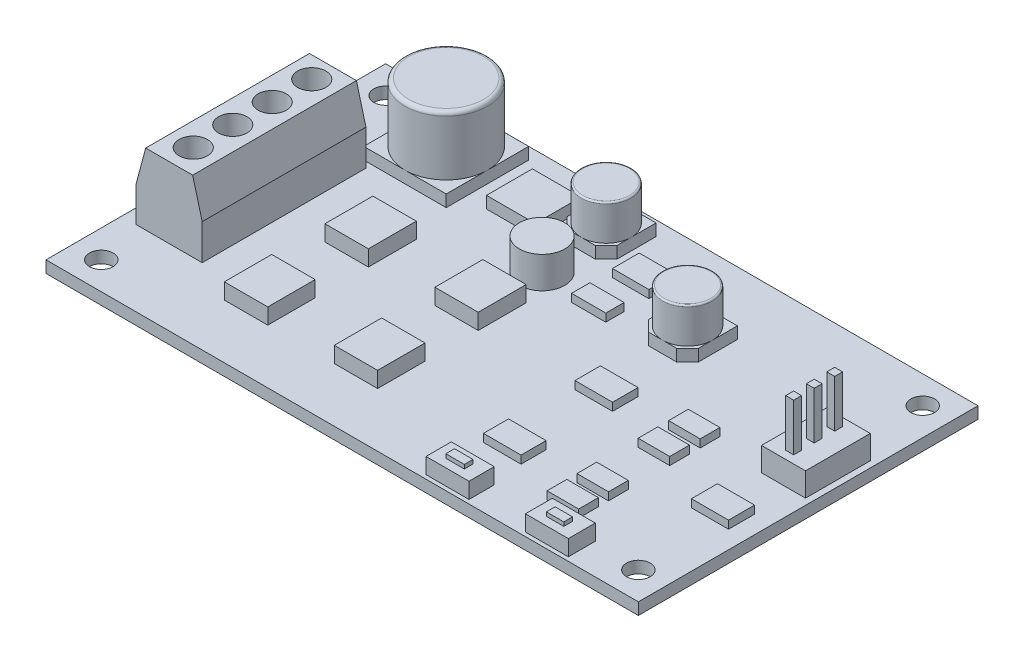
from build123d import *
from OCP.BRepFilletAPI import BRepFilletAPI_MakeChamfer

# Parameters (mm, degrees)
SKETCH1_W                 = 75
SKETCH1_H                 = 43
BOSS_EXTRUDE1_DEPTH       = 1.5
SKETCH2_R                 = 1.5
CUT_EXTRUDE3_DEPTH        = 1.5
SKETCH3_R                 = 5.221134654
BOSS_EXTRUDE2_DEPTH       = 1.5
SKETCH3_3_R               = 5.221134654
BOSS_EXTRUDE3_DEPTH       = 9
SKETCH4_W                 = 8.355581573
SKETCH4_H                 = 20.734220939
BOSS_EXTRUDE4_DEPTH       = 9
CHAMFER1_SIZE             = 4.5
CHAMFER1_SIZE2            = 1.205771366
SKETCH6_R                 = 1.797997368
CUT_EXTRUDE5_DEPTH        = 4.5
LPATTERN1_COUNT           = 4
LPATTERN1_PITCH           = 5
SKETCH7_W                 = 2.5
SKETCH7_H                 = 2.5
CUT_EXTRUDE6_DEPTH        = 4.5
LPATTERN2_COUNT           = 4
LPATTERN2_PITCH           = 5
SKETCH8_W                 = 5.5
SKETCH8_H                 = 6
BOSS_EXTRUDE5_DEPTH       = 2
SKETCH8_H_2               = 6.070615465
BOSS_EXTRUDE5_2_DEPTH     = 2
SKETCH8_W_2               = 5.485495902
BOSS_EXTRUDE5_3_DEPTH     = 2
BOSS_EXTRUDE5_4_DEPTH     = 2
SKETCH9_W                 = 6.182542378
SKETCH9_H                 = 5.809457925
BOSS_EXTRUDE6_DEPTH       = 1.5
SKETCH10_R                = 2.875811074
BOSS_EXTRUDE7_DEPTH       = 4
SKETCH11_R                = 3.157141776
BOSS_EXTRUDE8_DEPTH       = 1.5
BOSS_EXTRUDE9_OUTLINE_R   = 3.157141776
BOSS_EXTRUDE9_DEPTH       = 6
BOSS_EXTRUDE9_START       = 1.5
BOSS_EXTRUDE9_2_OUTLINE_R = 3.157141776
BOSS_EXTRUDE9_2_DEPTH     = 4.5
SKETCH12_W                = 4.75842572
SKETCH12_H                = 3.223449682
BOSS_EXTRUDE10_DEPTH      = 1
SKETCH12_H_2              = 3.17233498
BOSS_EXTRUDE10_2_DEPTH    = 1
SKETCH12_W_2              = 4.613337759
SKETCH12_H_3              = 3.395519095
BOSS_EXTRUDE10_3_DEPTH    = 1
SKETCH12_W_3              = 4.69505577
SKETCH12_H_4              = 3.299228379
BOSS_EXTRUDE10_4_DEPTH    = 1
SKETCH13_W                = 4
SKETCH13_H                = 2.5
BOSS_EXTRUDE11_DEPTH      = 1
BOSS_EXTRUDE11_2_DEPTH    = 1
BOSS_EXTRUDE11_3_DEPTH    = 1
BOSS_EXTRUDE11_4_DEPTH    = 1
SKETCH13_W_2              = 4.332523778
SKETCH13_H_2              = 2.320994881
BOSS_EXTRUDE11_5_DEPTH    = 1
SKETCH14_W                = 5.436373471
SKETCH14_H                = 3.197866748
BOSS_EXTRUDE12_DEPTH      = 2
SKETCH14_W_2              = 5.43637347
SKETCH14_H_2              = 3.411057864
BOSS_EXTRUDE12_2_DEPTH    = 2
SKETCH15_W                = 2.349877762
SKETCH15_H                = 1.101505201
SKETCH15_W_2              = 2.203010403
BOSS_EXTRUDE13_DEPTH      = 0.5
SKETCH16_W                = 5.570387715
SKETCH16_H                = 8.20084858
BOSS_EXTRUDE14_DEPTH      = 3
SKETCH17_W                = 1
SKETCH17_H                = 1
BOSS_EXTRUDE15_DEPTH      = 6
LPATTERN3_COUNT           = 3
LPATTERN3_PITCH           = 2.6
CHAMFER2_SIZE             = 0.5
CHAMFER2_SIZE2            = 0.866025404
FILLET1_R                 = 0.5
FILLET2_R                 = 0.2
FILLET3_R                 = 0.2


# Read off the part's stored shape, not the designer's step: Boss-Extrude9
with BuildPart() as part:
    # Sketch1 → Boss-Extrude1 (new body)
    with BuildSketch(Plane(origin=(0, 0, 0), x_dir=(1, 0, 0), z_dir=(0, 1, 0))):
        with Locations((37.5, 21.5)):
            Rectangle(SKETCH1_W, SKETCH1_H)
    extrude(amount=BOSS_EXTRUDE1_DEPTH)

    # Sketch2 → Cut-Extrude3 (cut)
    with BuildSketch(Plane(origin=(0, 1.5, 0), x_dir=(1, 0, 0), z_dir=(0, 1, 0))):
        with Locations(Location((3.5, 39.5, 0), (0, 0, 270))):
            Circle(SKETCH2_R)
        with Locations(Location((71.5, 39.5, 0), (0, 0, 270))):
            Circle(SKETCH2_R)
        with Locations(Location((71.5, 3.5, 0), (0, 0, 270))):
            Circle(SKETCH2_R)
        with Locations(Location((3.5, 3.5, 0), (0, 0, 270))):
            Circle(SKETCH2_R)
    extrude(amount=-CUT_EXTRUDE3_DEPTH, mode=Mode.SUBTRACT)


with BuildPart() as body_2:
    # Sketch3 → Boss-Extrude2 (new body)
    with BuildSketch(Plane(origin=(0, 1.5, 0), x_dir=(1, 0, 0), z_dir=(0, 1, 0))):
        with BuildLine():
            Line((9.174762249, 41.49737644), (9.174762249, 36.276241794))
            ThreePointArc((9.174762249, 36.276241794), (10.703997186, 39.968141508), (14.395896902, 41.49737644))
            Line((14.395896902, 41.49737644), (9.174762249, 41.49737644))
        make_face()
        with Locations((14.395896902, 36.276241787)):
            Circle(SKETCH3_R)
        with BuildLine():
            Line((19.617031556, 41.49737644), (14.395896902, 41.49737644))
            ThreePointArc((14.395896902, 41.49737644), (18.087796621, 39.968141506), (19.617031556, 36.276241787))
            Line((19.617031556, 36.276241787), (19.617031556, 41.49737644))
        make_face()
        with BuildLine():
            ThreePointArc((19.617031556, 36.276241787), (18.087796632, 32.584342079), (14.395896934, 31.055107133))
            Line((14.395896934, 31.055107133), (17.830593616, 31.055107133))
            Line((17.830593616, 31.055107133), (19.617031556, 32.841545073))
            Line((19.617031556, 32.841545073), (19.617031556, 36.276241787))
        make_face()
        Polygon((19.617031556, 32.841545073), (17.830593616, 31.055107133), (19.617031556, 31.055107133), align=None)
        Polygon((10.961200189, 31.055107133), (9.174762249, 32.841545073), (9.174762249, 31.055107133), align=None)
        with BuildLine():
            Line((9.174762249, 36.276241794), (9.174762249, 32.841545073))
            Line((9.174762249, 32.841545073), (10.961200189, 31.055107133))
            Line((10.961200189, 31.055107133), (14.395896934, 31.055107133))
            ThreePointArc((14.395896934, 31.055107133), (10.703997192, 32.584342059), (9.174762249, 36.276241794))
        make_face()
    extrude(amount=BOSS_EXTRUDE2_DEPTH)

    # Sketch3<3> → Boss-Extrude3 (add)
    with BuildSketch(Plane(origin=(0, 1.5, 0), x_dir=(1, 0, 0), z_dir=(0, 1, 0))):
        with Locations(Location((14.395896902, 36.276241787, 0), (0, 0, 270))):
            Circle(SKETCH3_3_R)
    extrude(amount=BOSS_EXTRUDE3_DEPTH)

    # Fillet1
    fillet1_edges = [body_2.edges().sort_by_distance(p)[0] for p in [
        (14.395896902, 10.5, -41.49737644),
    ]]
    fillet(fillet1_edges, radius=FILLET1_R)


with BuildPart() as body_3:
    # Sketch4 → Boss-Extrude4 (new body)
    with BuildSketch(Plane(origin=(0, 1.5, 0), x_dir=(1, 0, 0), z_dir=(0, 1, 0))):
        with Locations((6.026906426, 19.936405532)):
            Rectangle(SKETCH4_W, SKETCH4_H)
    extrude(amount=BOSS_EXTRUDE4_DEPTH)

    # Chamfer1: one chamfer whose edges measure the first distance from different faces: ONE call of the kernel's chamfer builder (chamfer() names one face for all edges)
    chamfer1_edges_1 = [body_3.edges().sort_by_distance(p)[0] for p in [
        (1.849115639, 10.5, -19.936405532),
    ]]
    chamfer1_side_1 = [body_3.faces().sort_by_distance(p)[0] for p in [
        (1.849115639, 6, -19.936405532),
    ]]
    chamfer1_edges_2 = [body_3.edges().sort_by_distance(p)[0] for p in [
        (10.204697212, 10.5, -19.936405532),
    ]]
    chamfer1_side_2 = [body_3.faces().sort_by_distance(p)[0] for p in [
        (10.204697212, 6, -19.936405532),
    ]]
    chamfer1 = BRepFilletAPI_MakeChamfer(body_3.part.solid().wrapped)
    for e in chamfer1_edges_1:
        chamfer1.Add(CHAMFER1_SIZE, CHAMFER1_SIZE2, e.wrapped, chamfer1_side_1[0].wrapped)  # the first distance lies on this face
    for e in chamfer1_edges_2:
        chamfer1.Add(CHAMFER1_SIZE, CHAMFER1_SIZE2, e.wrapped, chamfer1_side_2[0].wrapped)  # the first distance lies on this face
    add(Compound.cast(chamfer1.Shape()), mode=Mode.REPLACE)

    # Sketch6 → Cut-Extrude5 (cut)
    with BuildSketch(Plane(origin=(0, 10.5, 0), x_dir=(1, 0, 0), z_dir=(0, 1, 0))):
        with Locations(Location((6.021763667, 27.62235107, 0), (0, 0, 270))):
            Circle(SKETCH6_R)
    cut_extrude5 = extrude(amount=-CUT_EXTRUDE5_DEPTH, mode=Mode.SUBTRACT)

    # LPattern1: Cut-Extrude5 ×4
    with Locations(*[(0, 0, i * LPATTERN1_PITCH) for i in range(1, LPATTERN1_COUNT)]):
        add(cut_extrude5, mode=Mode.SUBTRACT)

    # Sketch7 → Cut-Extrude6 (cut)
    with BuildSketch(Plane.ZY.offset(-1.849115639)):
        with Locations((-27.62235107, 3.75)):
            Rectangle(SKETCH7_W, SKETCH7_H)
    cut_extrude6 = extrude(amount=-CUT_EXTRUDE6_DEPTH, mode=Mode.SUBTRACT)

    # LPattern2: Cut-Extrude6 ×4
    with Locations(*[(0, 0, i * LPATTERN2_PITCH) for i in range(1, LPATTERN2_COUNT)]):
        add(cut_extrude6, mode=Mode.SUBTRACT)

    # Chamfer2
    chamfer2_edges = [body_3.edges().sort_by_distance(p)[0] for p in [
        (1.849115639, 3.75, -26.37235107),
        (1.849115639, 5, -27.62235107),
        (1.849115639, 3.75, -28.87235107),
        (1.849115639, 2.5, -27.62235107),
        (1.849115639, 3.75, -21.37235107),
        (1.849115639, 5, -22.62235107),
        (1.849115639, 3.75, -23.87235107),
        (1.849115639, 2.5, -22.62235107),
        (1.849115639, 3.75, -16.37235107),
        (1.849115639, 5, -17.62235107),
        (1.849115639, 3.75, -18.87235107),
        (1.849115639, 2.5, -17.62235107),
        (1.849115639, 3.75, -11.37235107),
        (1.849115639, 5, -12.62235107),
        (1.849115639, 3.75, -13.87235107),
        (1.849115639, 2.5, -12.62235107),
    ]]
    chamfer2_side = [body_3.faces().sort_by_distance(p)[0] for p in [
        (1.849115639, 3.75, -19.868347455),
    ]]
    chamfer(chamfer2_edges, length=CHAMFER2_SIZE, length2=CHAMFER2_SIZE2, reference=chamfer2_side[0])


with BuildPart() as body_4:
    # Sketch8 → Boss-Extrude5 (new body)
    with BuildSketch(Plane(origin=(0, 1.5, 0), x_dir=(1, 0, 0), z_dir=(0, 1, 0))):
        with Locations((18.451726118, 9.875042273)):
            Rectangle(SKETCH8_W, SKETCH8_H)
    extrude(amount=BOSS_EXTRUDE5_DEPTH)


with BuildPart() as body_5:
    # Sketch8 → Boss-Extrude5 2 (new body)
    with BuildSketch(Plane(origin=(0, 1.5, 0), x_dir=(1, 0, 0), z_dir=(0, 1, 0))):
        with Locations((18.451726118, 22.647353546)):
            Rectangle(SKETCH8_W, SKETCH8_H_2)
    extrude(amount=BOSS_EXTRUDE5_2_DEPTH)


with BuildPart() as body_6:
    # Sketch8 → Boss-Extrude5 3 (new body)
    with BuildSketch(Plane(origin=(0, 1.5, 0), x_dir=(1, 0, 0), z_dir=(0, 1, 0))):
        with Locations((32.365114797, 22.647353546)):
            Rectangle(SKETCH8_W_2, SKETCH8_H_2)
    extrude(amount=BOSS_EXTRUDE5_3_DEPTH)


with BuildPart() as body_7:
    # Sketch8 → Boss-Extrude5 4 (new body)
    with BuildSketch(Plane(origin=(0, 1.5, 0), x_dir=(1, 0, 0), z_dir=(0, 1, 0))):
        with Locations((32.365114797, 9.875042273)):
            Rectangle(SKETCH8_W_2, SKETCH8_H)
    extrude(amount=BOSS_EXTRUDE5_4_DEPTH)


with BuildPart() as body_8:
    # Sketch9 → Boss-Extrude6 (new body)
    with BuildSketch(Plane(origin=(0, 1.5, 0), x_dir=(1, 0, 0), z_dir=(0, 1, 0))):
        with Locations((25.403033281, 36.358052628)):
            Rectangle(SKETCH9_W, SKETCH9_H)
    extrude(amount=BOSS_EXTRUDE6_DEPTH)


with BuildPart() as body_9:
    # Sketch10 → Boss-Extrude7 (new body)
    with BuildSketch(Plane(origin=(0, 1.5, 0), x_dir=(1, 0, 0), z_dir=(0, 1, 0))):
        with Locations(Location((32.775261251, 30.033053049, 0), (0, 0, 270))):
            Circle(SKETCH10_R)
    extrude(amount=BOSS_EXTRUDE7_DEPTH)


with BuildPart() as body_10:
    # Sketch11 → Boss-Extrude8 (new body)
    with BuildSketch(Plane(origin=(0, 1.5, 0), x_dir=(1, 0, 0), z_dir=(0, 1, 0))):
        with BuildLine():
            Line((29.759662126, 41.160891659), (29.759662126, 38.003749883))
            ThreePointArc((29.759662126, 38.003749883), (30.684367543, 40.236186242), (32.916803902, 41.160891659))
            Line((32.916803902, 41.160891659), (29.759662126, 41.160891659))
        make_face()
        with Locations((32.916803902, 38.003749883)):
            Circle(SKETCH11_R)
        with BuildLine():
            Line((36.073945678, 41.160891659), (32.916803902, 41.160891659))
            ThreePointArc((32.916803902, 41.160891659), (35.149240261, 40.236186242), (36.073945678, 38.003749883))
            Line((36.073945678, 38.003749883), (36.073945678, 41.160891659))
        make_face()
        with BuildLine():
            ThreePointArc((36.073945678, 38.003749883), (35.149240247, 35.77131351), (32.916803863, 34.846608107))
            Line((32.916803863, 34.846608107), (34.70968574, 34.846608107))
            Line((34.70968574, 34.846608107), (36.073945678, 36.210868045))
            Line((36.073945678, 36.210868045), (36.073945678, 38.003749883))
        make_face()
        with BuildLine():
            Line((29.759662126, 38.003749883), (29.759662126, 36.210868045))
            Line((29.759662126, 36.210868045), (31.123922064, 34.846608107))
            Line((31.123922064, 34.846608107), (32.916803863, 34.846608107))
            ThreePointArc((32.916803863, 34.846608107), (30.684367529, 35.771313538), (29.759662126, 38.003749883))
        make_face()
        with BuildLine():
            Line((46.191446062, 35.03112029), (46.191446062, 31.873978515))
            ThreePointArc((46.191446062, 31.873978515), (47.11615147, 34.106414865), (49.348587813, 35.03112029))
            Line((49.348587813, 35.03112029), (46.191446062, 35.03112029))
        make_face()
        with Locations((49.348587838, 31.873978515)):
            Circle(SKETCH11_R)
        with BuildLine():
            ThreePointArc((49.348587813, 35.03112029), (51.581024188, 34.106414882), (52.505729613, 31.873978515))
            Line((52.505729613, 31.873978515), (52.505729613, 35.03112029))
            Line((52.505729613, 35.03112029), (49.348587813, 35.03112029))
        make_face()
        with BuildLine():
            Line((49.348587838, 28.716836739), (51.141469675, 28.716836739))
            Line((51.141469675, 28.716836739), (52.505729613, 30.081096677))
            Line((52.505729613, 30.081096677), (52.505729613, 31.873978515))
            ThreePointArc((52.505729613, 31.873978515), (51.581024196, 29.641542156), (49.348587838, 28.716836739))
        make_face()
        with BuildLine():
            Line((47.555706, 28.716836739), (49.348587838, 28.716836739))
            ThreePointArc((49.348587838, 28.716836739), (47.116151479, 29.641542156), (46.191446062, 31.873978515))
            Line((46.191446062, 31.873978515), (46.191446062, 30.081096677))
            Line((46.191446062, 30.081096677), (47.555706, 28.716836739))
        make_face()
    extrude(amount=BOSS_EXTRUDE8_DEPTH)

    # Boss-Extrude9 2 outline → Boss-Extrude9 2 (add)
    with BuildSketch(Plane(origin=(0, 1.5, 0), x_dir=(1, 0, 0), z_dir=(0, 1, 0)).offset(BOSS_EXTRUDE9_START)):
        with Locations((32.916803902, 38.003749883)):
            Circle(BOSS_EXTRUDE9_2_OUTLINE_R)
    extrude(amount=BOSS_EXTRUDE9_2_DEPTH)

    # Fillet2
    fillet2_edges = [body_10.edges().sort_by_distance(p)[0] for p in [
        (29.759662126, 7.5, -38.003749883),
    ]]
    fillet(fillet2_edges, radius=FILLET2_R)


with BuildPart() as body_11:
    # Boss-Extrude9 outline → Boss-Extrude9 (new body)
    with BuildSketch(Plane(origin=(0, 1.5, 0), x_dir=(1, 0, 0), z_dir=(0, 1, 0))):
        with Locations((49.348587838, 31.873978515)):
            Circle(BOSS_EXTRUDE9_OUTLINE_R)
    extrude(amount=BOSS_EXTRUDE9_DEPTH)

    # Fillet3
    fillet3_edges = [body_11.edges().sort_by_distance(p)[0] for p in [
        (46.191446062, 7.5, -31.873978515),
    ]]
    fillet(fillet3_edges, radius=FILLET3_R)


with BuildPart() as body_12:
    # Sketch12 → Boss-Extrude10 (new body)
    with BuildSketch(Plane(origin=(0, 1.5, 0), x_dir=(1, 0, 0), z_dir=(0, 1, 0))):
        with Locations((50.100305913, 20.861181488)):
            Rectangle(SKETCH12_W, SKETCH12_H)
    extrude(amount=BOSS_EXTRUDE10_DEPTH)


with BuildPart() as body_13:
    # Sketch12 → Boss-Extrude10 2 (new body)
    with BuildSketch(Plane(origin=(0, 1.5, 0), x_dir=(1, 0, 0), z_dir=(0, 1, 0))):
        with Locations((50.100305913, 9.251345896)):
            Rectangle(SKETCH12_W, SKETCH12_H_2)
    extrude(amount=BOSS_EXTRUDE10_2_DEPTH)


with BuildPart() as body_14:
    # Sketch12 → Boss-Extrude10 3 (new body)
    with BuildSketch(Plane(origin=(0, 1.5, 0), x_dir=(1, 0, 0), z_dir=(0, 1, 0))):
        with Locations((40.11361774, 35.603435459)):
            Rectangle(SKETCH12_W_2, SKETCH12_H_3)
    extrude(amount=BOSS_EXTRUDE10_3_DEPTH)


with BuildPart() as body_15:
    # Sketch12 → Boss-Extrude10 4 (new body)
    with BuildSketch(Plane(origin=(0, 1.5, 0), x_dir=(1, 0, 0), z_dir=(0, 1, 0))):
        with Locations((70.400281137, 15.315792932)):
            Rectangle(SKETCH12_W_3, SKETCH12_H_4)
    extrude(amount=BOSS_EXTRUDE10_4_DEPTH)


with BuildPart() as body_16:
    # Sketch13 → Boss-Extrude11 (new body)
    with BuildSketch(Plane(origin=(0, 1.5, 0), x_dir=(1, 0, 0), z_dir=(0, 1, 0))):
        with Locations((60.043699294, 6.645397407)):
            Rectangle(SKETCH13_W, SKETCH13_H)
    extrude(amount=BOSS_EXTRUDE11_DEPTH)


with BuildPart() as body_17:
    # Sketch13 → Boss-Extrude11 2 (new body)
    with BuildSketch(Plane(origin=(0, 1.5, 0), x_dir=(1, 0, 0), z_dir=(0, 1, 0))):
        with Locations((60.043699294, 10.427231931)):
            Rectangle(SKETCH13_W, SKETCH13_H)
    extrude(amount=BOSS_EXTRUDE11_2_DEPTH)


with BuildPart() as body_18:
    # Sketch13 → Boss-Extrude11 3 (new body)
    with BuildSketch(Plane(origin=(0, 1.5, 0), x_dir=(1, 0, 0), z_dir=(0, 1, 0))):
        with Locations((60.043699294, 18.174485179)):
            Rectangle(SKETCH13_W, SKETCH13_H)
    extrude(amount=BOSS_EXTRUDE11_3_DEPTH)


with BuildPart() as body_19:
    # Sketch13 → Boss-Extrude11 4 (new body)
    with BuildSketch(Plane(origin=(0, 1.5, 0), x_dir=(1, 0, 0), z_dir=(0, 1, 0))):
        with Locations((60.043699294, 22.029753384)):
            Rectangle(SKETCH13_W, SKETCH13_H)
    extrude(amount=BOSS_EXTRUDE11_4_DEPTH)


with BuildPart() as body_20:
    # Sketch13 → Boss-Extrude11 5 (new body)
    with BuildSketch(Plane(origin=(0, 1.5, 0), x_dir=(1, 0, 0), z_dir=(0, 1, 0))):
        with Locations((40.109488838, 29.759717924)):
            Rectangle(SKETCH13_W_2, SKETCH13_H_2)
    extrude(amount=BOSS_EXTRUDE11_5_DEPTH)


with BuildPart() as body_21:
    # Sketch14 → Boss-Extrude12 (new body)
    with BuildSketch(Plane(origin=(0, 1.5, 0), x_dir=(1, 0, 0), z_dir=(0, 1, 0))):
        with Locations((50.333925212, 2.099600723)):
            Rectangle(SKETCH14_W, SKETCH14_H)
    extrude(amount=BOSS_EXTRUDE12_DEPTH)



with BuildPart() as body_22:
    # Sketch14 → Boss-Extrude12 2 (new body)
    with BuildSketch(Plane(origin=(0, 1.5, 0), x_dir=(1, 0, 0), z_dir=(0, 1, 0))):
        with Locations((62.912201085, 2.206196281)):
            Rectangle(SKETCH14_W_2, SKETCH14_H_2)
    extrude(amount=BOSS_EXTRUDE12_2_DEPTH)


with BuildPart() as body_21_1:
    add(body_21.part)

    add(body_22.part)  # Boss-Extrude13 merges body 22
    # Sketch15 → Boss-Extrude13 (add)
    with BuildSketch(Plane(origin=(0, 3.5, 0), x_dir=(1, 0, 0), z_dir=(0, 1, 0))):
        with Locations((50.244246173, 2.097261097)):
            Rectangle(SKETCH15_W, SKETCH15_H)
        with Locations((62.911555987, 2.097261097)):
            Rectangle(SKETCH15_W_2, SKETCH15_H)
    extrude(amount=BOSS_EXTRUDE13_DEPTH)


with BuildPart() as body_22_2:
    # Sketch16 → Boss-Extrude14 (new body)
    with BuildSketch(Plane(origin=(0, 1.5, 0), x_dir=(1, 0, 0), z_dir=(0, 1, 0))):
        with Locations((71.429480786, 26.043077239)):
            Rectangle(SKETCH16_W, SKETCH16_H)
    extrude(amount=BOSS_EXTRUDE14_DEPTH)

    # Sketch17 → Boss-Extrude15 (add)
    with BuildSketch(Plane(origin=(0, 4.5, 0), x_dir=(1, 0, 0), z_dir=(0, 1, 0))):
        with Locations((71.214674643, 28.643501529)):
            Rectangle(SKETCH17_W, SKETCH17_H)
    boss_extrude15 = extrude(amount=BOSS_EXTRUDE15_DEPTH)

    # LPattern3: Boss-Extrude15 ×3
    with Locations(*[(0, 0, i * LPATTERN3_PITCH) for i in range(1, LPATTERN3_COUNT)]):
        add(boss_extrude15)


solid = Compound([part.part, body_2.part, body_3.part, body_4.part, body_5.part, body_6.part, body_7.part, body_8.part, body_9.part, body_10.part, body_11.part, body_12.part, body_13.part, body_14.part, body_15.part, body_16.part, body_17.part, body_18.part, body_19.part, body_20.part, body_21_1.part, body_22_2.part])
